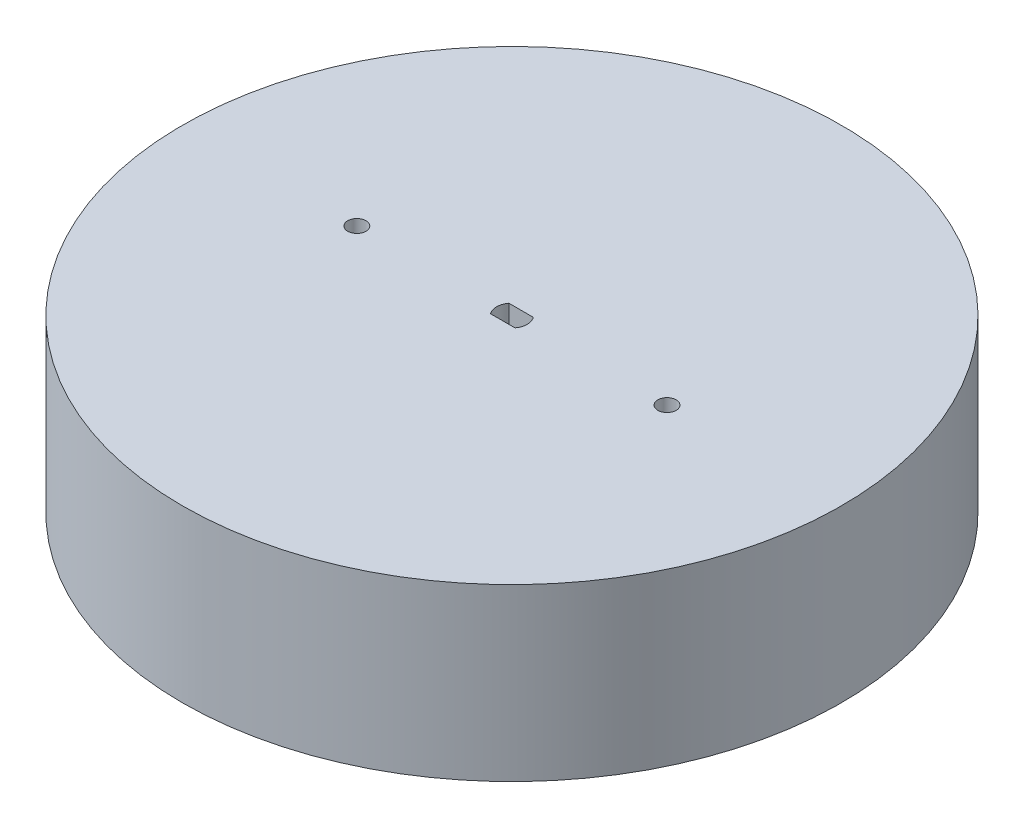
from build123d import *

# Parameters (mm, degrees)
SKETCH1_R           = 53.975
BOSS_EXTRUDE1_DEPTH = 8.89
BOSS_EXTRUDE2_START = -19.05
SKETCH1_4_R         = 53.975
SKETCH1_4_R_2       = 47.625
BOSS_EXTRUDE2_DEPTH = 19.05
CUT_EXTRUDE1_DEPTH  = 25.4
BOSS_EXTRUDE3_START = 3.4925
SKETCH3_R           = 47.625
SKETCH3_R_2         = 34.925
BOSS_EXTRUDE3_DEPTH = 3.4925
SKETCH4_R           = 1.5
CUT_EXTRUDE2_DEPTH  = 21.2725


with BuildPart() as part:
    # Sketch1 → Boss-Extrude1 (new body)
    with BuildSketch(Plane(origin=(0, 0, 0), x_dir=(1, 0, 0), z_dir=(0, 1, 0))):
        Circle(SKETCH1_R)
    extrude(amount=BOSS_EXTRUDE1_DEPTH)

    # Sketch1<4> → Boss-Extrude2 (add)
    with BuildSketch(Plane(origin=(0, 0, 0), x_dir=(1, 0, 0), z_dir=(0, 1, 0)).offset(BOSS_EXTRUDE2_START)):
        Circle(SKETCH1_4_R)
        Circle(SKETCH1_4_R_2, mode=Mode.SUBTRACT)
    extrude(amount=BOSS_EXTRUDE2_DEPTH)

    # Sketch2 → Cut-Extrude1 (cut)
    with BuildSketch(Plane(origin=(0, 8.89, 0), x_dir=(1, 0, 0), z_dir=(0, 1, 0))):
        with BuildLine():
            Line((-2, 1.5), (2, 1.5))
            ThreePointArc((2, 1.5), (2.5, 0), (2, -1.5))
            Line((2, -1.5), (-2, -1.5))
            ThreePointArc((-2, -1.5), (-2.5, 0), (-2, 1.5))
        make_face()
    extrude(amount=-CUT_EXTRUDE1_DEPTH, mode=Mode.SUBTRACT)

    # Sketch3 → Boss-Extrude3 (add)
    with BuildSketch(Plane.XZ.offset(BOSS_EXTRUDE3_START)):
        Circle(SKETCH3_R)
        Circle(SKETCH3_R_2, mode=Mode.SUBTRACT)
    extrude(amount=-BOSS_EXTRUDE3_DEPTH)

    # Sketch4 → Cut-Extrude2 (cut)
    with BuildSketch(Plane(origin=(0, 8.89, 0), x_dir=(1, 0, 0), z_dir=(0, 1, 0))):
        with Locations((25.4, 0)):
            Circle(SKETCH4_R)
        with Locations((-25.4, 0)):
            Circle(SKETCH4_R)
    extrude(amount=-CUT_EXTRUDE2_DEPTH, mode=Mode.SUBTRACT)


solid = part.part
